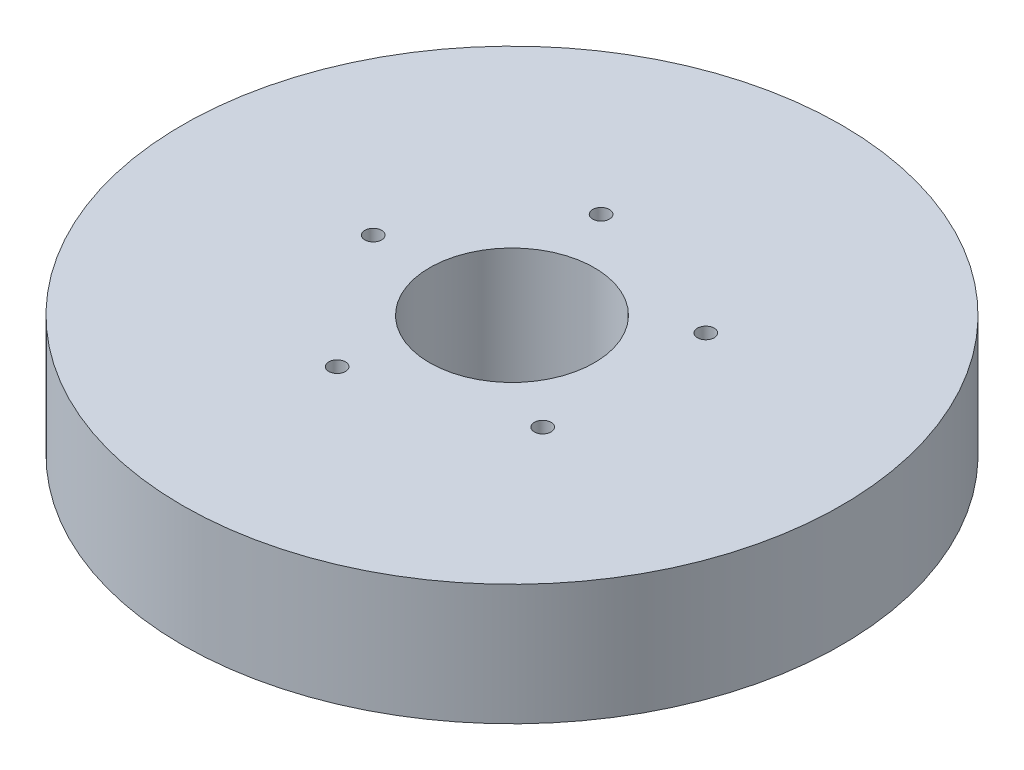
from build123d import *

# Parameters (mm, degrees)
SKETCH1_R           = 60
BOSS_EXTRUDE1_DEPTH = 22
SKETCH2_R           = 15
CUT_EXTRUDE1_DEPTH  = 88.658428003
SKETCH3_R           = 1.526175747
CUT_EXTRUDE2_DEPTH  = 13.933568259
CIRPATTERN1_COUNT   = 5


with BuildPart() as part:
    # Sketch1 → Boss-Extrude1 (new body)
    with BuildSketch(Plane(origin=(0, 0, 0), x_dir=(1, 0, 0), z_dir=(0, 1, 0))):
        Circle(SKETCH1_R)
    extrude(amount=BOSS_EXTRUDE1_DEPTH)

    # Sketch2 → Cut-Extrude1 (cut, through all)
    with BuildSketch(Plane(origin=(0, 0, 0), x_dir=(1, 0, 0), z_dir=(0, 1, 0))):
        Circle(SKETCH2_R)
    extrude(amount=CUT_EXTRUDE1_DEPTH, mode=Mode.SUBTRACT)

    # Sketch3 → Cut-Extrude2 (cut)
    with BuildSketch(Plane(origin=(0, 22, 0), x_dir=(1, 0, 0), z_dir=(0, 1, 0))):
        with Locations((-25.262727917, 0)):
            Circle(SKETCH3_R)
    cut_extrude2 = extrude(amount=-CUT_EXTRUDE2_DEPTH, mode=Mode.SUBTRACT)

    # CirPattern1: Cut-Extrude2 ×5 about axis
    cirpattern1_axis = Axis((0, 0, 0), (0, 1, 0))
    for i in range(1, CIRPATTERN1_COUNT):
        add(cut_extrude2.rotate(cirpattern1_axis, i * 360 / CIRPATTERN1_COUNT), mode=Mode.SUBTRACT)


solid = part.part
